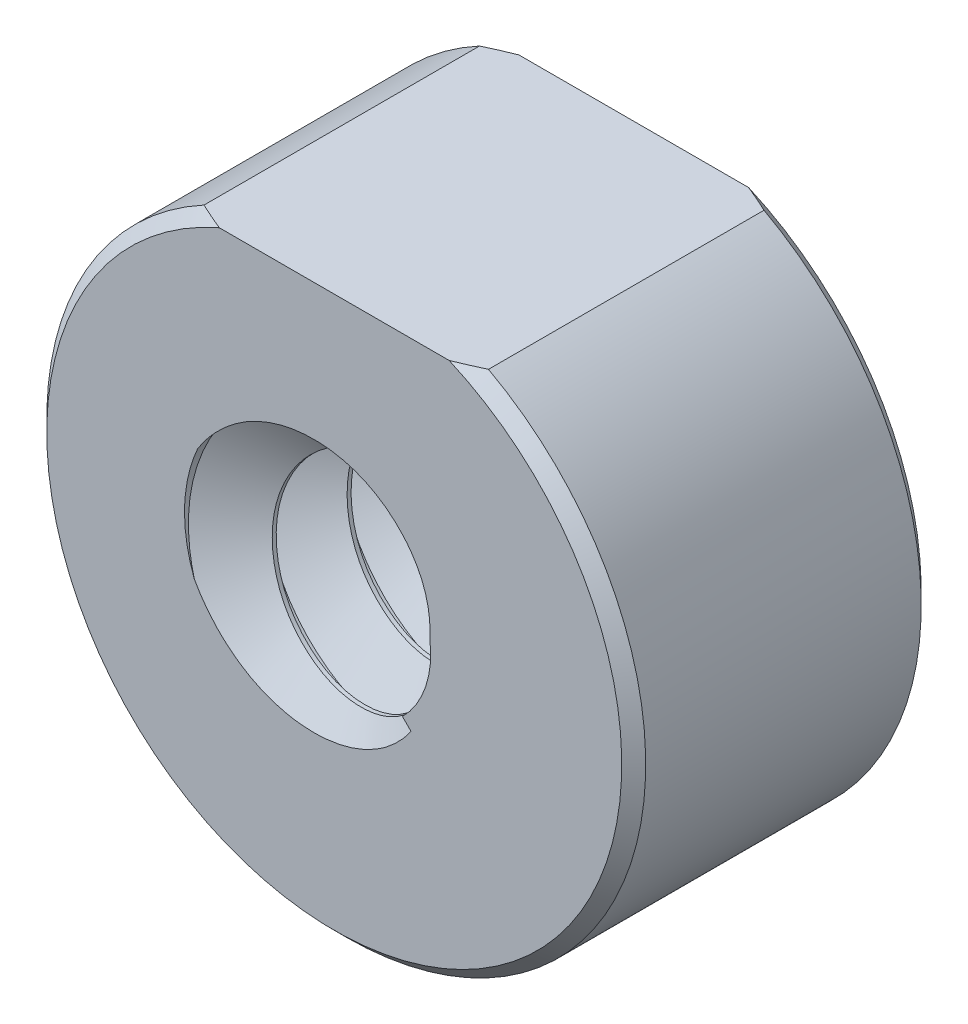
from build123d import *

# Parameters (mm, degrees)
SKETCH1_R           = 2.0447
BOSS_EXTRUDE1_DEPTH = 6.35
CUT_SWEEP1_PITCH    = 1.5875
CHAMFER1_SIZE       = 0.254


with BuildPart() as part:
    # Sketch1 → Boss-Extrude1 (new body)
    with BuildSketch(Plane.XY):
        with BuildLine():
            Line((-3.01608289, 5.588), (3.01608289, 5.588))
            ThreePointArc((3.01608289, 5.588), (0, -6.35), (-3.01608289, 5.588))
        make_face()
        Circle(SKETCH1_R, mode=Mode.SUBTRACT)
    extrude(amount=BOSS_EXTRUDE1_DEPTH)

    # Cut-Sweep1: arcs per turn and ends read off the stored shape
    # Cut-Sweep1: the profile of Sketch2 profile screwed along a right-hand helix through 4.75 turns, 8 arcs to a turn; built about Z, then put on its axis
    cut_sweep1_z = Axis((0, 0, 0), (0, 0, 1))
    cut_sweep1_corners = [(2.0444, 0, -1.339811764), (3.175, 0, -0.68705955), (3.175, 0, -0.48862205), (2.0444, 0, 0.164130164)]
    with BuildLine(mode=Mode.PRIVATE) as cut_sweep1_profile:
        Line(cut_sweep1_corners[0], cut_sweep1_corners[1])
        Line(cut_sweep1_corners[1], cut_sweep1_corners[2])
        Line(cut_sweep1_corners[2], cut_sweep1_corners[3])
        Line(cut_sweep1_corners[3], cut_sweep1_corners[0])
    cut_sweep1_cap = Face(cut_sweep1_profile.wire())
    cut_sweep1_turn_angles = [0, 22.5, 45, 67.5, 90, 112.5, 135, 157.5, 180, 202.5, 225, 247.5, 270, 292.5, 315, 337.5, 360]
    cut_sweep1_turn_weights = [1, 0.9238795325112867, 1, 0.9238795325112867, 1, 0.9238795325112867, 1, 0.9238795325112867, 1, 0.9238795325112867, 1, 0.9238795325112867, 1, 0.9238795325112867, 1, 0.9238795325112867, 1]
    cut_sweep1_turn_rails = [Edge.make_bspline([Vector(p[0], p[1], 0).rotate(cut_sweep1_z, cut_sweep1_turn_angles[k]) / cut_sweep1_turn_weights[k] + Vector(0, 0, p[2] + CUT_SWEEP1_PITCH * cut_sweep1_turn_angles[k] / 360) for k in range(17)], [0, 0, 0, 1, 1, 2, 2, 3, 3, 4, 4, 5, 5, 6, 6, 7, 7, 8, 8, 8], 2, cut_sweep1_turn_weights) for p in cut_sweep1_corners]
    cut_sweep1_turn_sides = [Face.make_surface_from_curves(cut_sweep1_turn_rails[p[0]], cut_sweep1_turn_rails[p[1]]) for p in [(0, 1), (1, 2), (2, 3), (3, 0)]]
    cut_sweep1_last_angles = [1440, 1462.5, 1485, 1507.5, 1530, 1552.5, 1575, 1597.5, 1620, 1642.5, 1665, 1687.5, 1710]
    cut_sweep1_last_weights = [1, 0.9238795325112867, 1, 0.9238795325112867, 1, 0.9238795325112867, 1, 0.9238795325112867, 1, 0.9238795325112867, 1, 0.9238795325112769, 1]
    cut_sweep1_last_rails = [Edge.make_bspline([Vector(p[0], p[1], 0).rotate(cut_sweep1_z, cut_sweep1_last_angles[k]) / cut_sweep1_last_weights[k] + Vector(0, 0, p[2] + CUT_SWEEP1_PITCH * cut_sweep1_last_angles[k] / 360) for k in range(13)], [0, 0, 0, 1, 1, 2, 2, 3, 3, 4, 4, 5, 5, 6, 6, 6], 2, cut_sweep1_last_weights) for p in cut_sweep1_corners]
    cut_sweep1_last_sides = [Face.make_surface_from_curves(cut_sweep1_last_rails[p[0]], cut_sweep1_last_rails[p[1]]) for p in [(0, 1), (1, 2), (2, 3), (3, 0)]]
    cut_sweep1 = Plane(origin=(0, 0, 0), x_dir=(0.7071067811865512, 0.7071067811865438, 0), z_dir=(0, 0, 1)) * Solid(Shell([*[p.moved(Location((0, 0, CUT_SWEEP1_PITCH * i))) for i in range(4) for p in cut_sweep1_turn_sides], *cut_sweep1_last_sides, cut_sweep1_cap, cut_sweep1_cap.rotate(cut_sweep1_z, 1710).moved(Location((0, 0, CUT_SWEEP1_PITCH * 1710 / 360)))]))
    add(cut_sweep1, mode=Mode.SUBTRACT)

    # Chamfer1
    chamfer1_edges = [part.edges().sort_by_distance(p)[0] for p in [
        (0, -6.35, 0),
        (0, -6.35, 6.35),
    ]]
    chamfer(chamfer1_edges, length=CHAMFER1_SIZE)


solid = part.part
